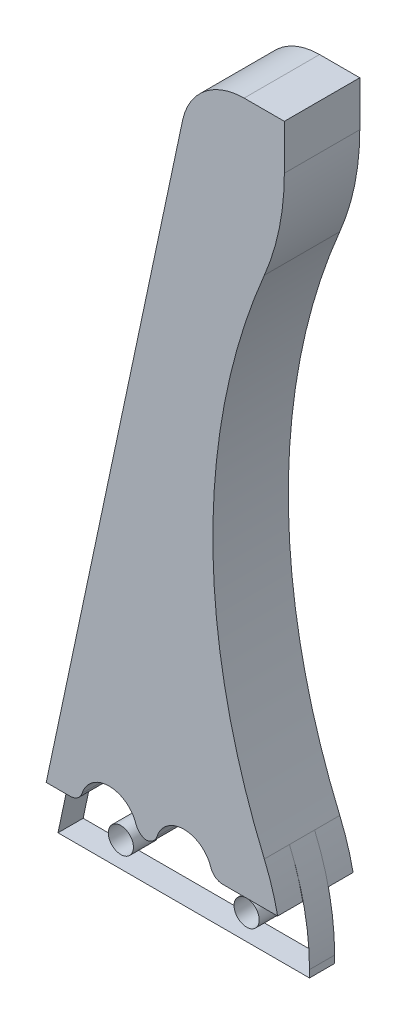
from build123d import *

# Parameters (mm, degrees)
SALIENTE_EXTRUIR1_DEPTH      = 2
REDONDEO1_R                  = 5
REDONDEO2_R                  = 20
REDONDEO3_R                  = 20
CROQUIS3_R                   = 1
CORTAR_EXTRUIR1_DEPTH        = 2
SALIENTE_EXTRUIR2_DEPTH      = 2
SALIENTE_EXTRUIR2_DEPTH_BACK = 4
CORTAR_EXTRUIR2_DEPTH        = 2
REDONDEO4_R                  = 1
CORTAR_EXTRUIR3_START        = -2
CORTAR_EXTRUIR3_DEPTH        = 2
REDONDEO5_R                  = 1


with BuildPart() as part:
    # Croquis1 → Saliente-Extruir1 (new body)
    with BuildSketch(Plane.XY):
        with BuildLine():
            Line((0, 0), (20, 0))
            Line((20, 0), (20, 5))
            ThreePointArc((20, 5), (14.314768742, 28.5), (20, 52))
            Line((20, 52), (20, 60))
            Line((20, 60), (12.7533937, 60))
            Line((12.7533937, 60), (0, 0))
        make_face()
    extrude(amount=SALIENTE_EXTRUIR1_DEPTH)

    # Redondeo1
    redondeo1_edges = [part.edges().sort_by_distance(p)[0] for p in [
        (12.7533937, 60, 1),
    ]]
    fillet(redondeo1_edges, radius=REDONDEO1_R)

    # Redondeo2
    redondeo2_edges = [part.edges().sort_by_distance(p)[0] for p in [
        (20, 52, 1),
    ]]
    fillet(redondeo2_edges, radius=REDONDEO2_R)

    # Redondeo3
    redondeo3_edges = [part.edges().sort_by_distance(p)[0] for p in [
        (20, 5, 1),
    ]]
    fillet(redondeo3_edges, radius=REDONDEO3_R)

    # Croquis3 → Cortar-Extruir1 (cut)
    with BuildSketch(Plane.XY.offset(2)):
        with Locations((5, 2)):
            Circle(CROQUIS3_R)
        with Locations((15, 2)):
            Circle(CROQUIS3_R)
    extrude(amount=-CORTAR_EXTRUIR1_DEPTH, mode=Mode.SUBTRACT)

    # Croquis4 → Saliente-Extruir2 (add, two sides: drawn at the far end of the back side and taken through both)
    with BuildSketch(Plane.XY.offset(2).offset(-SALIENTE_EXTRUIR2_DEPTH_BACK)):
        with BuildLine():
            Line((1.062782808, 5), (19.467344823, 5))
            ThreePointArc((19.467344823, 5), (19.022081332, 6.725242685), (18.407753369, 8.397762657))
            ThreePointArc((18.407753369, 8.397762657), (14.314768742, 28.5), (18.407753369, 48.602237343))
            ThreePointArc((18.407753369, 48.602237343), (19.597896155, 52.432082505), (20, 56.422379023))
            Line((20, 56.422379023), (20, 60))
            Line((20, 60), (16.802313866, 60))
            ThreePointArc((16.802313866, 60), (13.655711911, 58.885729807), (11.911575863, 56.039558454))
            Line((11.911575863, 56.039558454), (1.062782808, 5))
        make_face()
    extrude(amount=SALIENTE_EXTRUIR2_DEPTH + SALIENTE_EXTRUIR2_DEPTH_BACK)

    # Croquis5 → Cortar-Extruir2 (cut)
    with BuildSketch(Plane.XY.offset(4)):
        with BuildLine():
            Line((3.812782808, 5), (8.312782808, 5))
            ThreePointArc((8.312782808, 5), (6.062782808, 7.25), (3.812782808, 5))
        make_face()
        with BuildLine():
            Line((9.765782808, 5), (14.265782808, 5))
            ThreePointArc((14.265782808, 5), (12.015782808, 7.25), (9.765782808, 5))
        make_face()
    extrude(amount=-CORTAR_EXTRUIR2_DEPTH, mode=Mode.SUBTRACT)

    # Redondeo4
    # the kernel refuses this fillet: 1 mm, written as the material it takes off along each edge
    with BuildSketch(Plane(origin=(8.312782808, 5, 6.105823048), x_dir=(1, 0, 0), z_dir=(0, 0, -1)), Plane(origin=(14.265782808, 5, 6.105823048), x_dir=(1, 0, 0), z_dir=(0, 0, -1))) as redondeo4_piece_1:
        with BuildLine():
            CenterArc((0.842329219, -1), REDONDEO4_R, 90, 72.079786861)
            ThreePointArc((-0.109156694, -0.692307692), (-0.0274567, -0.350430137), (0, 0))
            Line((0, 0), (0.842329219, 0))
        make_face()
    extrude(amount=4.105823048, mode=Mode.SUBTRACT)
    with BuildSketch(Plane(origin=(3.812782808, 5, 6.105823048), x_dir=(-1, 0, 0), z_dir=(0, 0, -1))) as redondeo4_piece_2:
        with BuildLine():
            CenterArc((0.842329219, 1), REDONDEO4_R, 197.920213139, 72.079786861)
            ThreePointArc((-0.109156694, 0.692307692), (-0.0274567, 0.350430137), (0, 0))
            Line((0, 0), (0.842329219, 0))
        make_face()
    extrude(amount=4.105823048, mode=Mode.SUBTRACT)
    with BuildSketch(Plane(origin=(9.765782808, 5, 6.105823048), x_dir=(0.15574672772788725, 0.9877970220657962, 0), z_dir=(0, 0, -1))) as redondeo4_piece_3:
        with BuildLine():
            CenterArc((0.856607003, -0.987797022), REDONDEO4_R, 98.96010657, 72.079786861)
            Line((-0.13119002, -0.832050294), (0, 0))
            ThreePointArc((0, 0), (0.350430137, -0.0274567), (0.700860275, 0))
        make_face()
    extrude(amount=4.105823048, mode=Mode.SUBTRACT)

    # Croquis6 → Cortar-Extruir3 (cut)
    with BuildSketch(Plane(origin=(0, 0, -2), x_dir=(-1, 0, 0), z_dir=(0, 0, -1)).offset(CORTAR_EXTRUIR3_START)):
        with BuildLine():
            Line((-8.312782808, 5), (-3.812782808, 5))
            ThreePointArc((-3.812782808, 5), (-6.062782808, 7.25), (-8.312782808, 5))
        make_face()
        with BuildLine():
            Line((-14.242782808, 5), (-9.742782808, 5))
            ThreePointArc((-9.742782808, 5), (-11.992782808, 7.25), (-14.242782808, 5))
        make_face()
    extrude(amount=CORTAR_EXTRUIR3_DEPTH, mode=Mode.SUBTRACT)

    # Redondeo5
    # the kernel refuses this fillet: 1 mm, written as the material it takes off along each edge
    with BuildSketch(Plane(origin=(3.812782808, 5, 2.105823048), x_dir=(-1, 0, 0), z_dir=(0, 0, -1))) as redondeo5_piece_1_section:
        with BuildLine():
            CenterArc((0.842329219, 1), REDONDEO5_R, 197.920213139, 72.079786861)
            ThreePointArc((-0.109156694, 0.692307692), (-0.0274567, 0.350430137), (0, 0))
            Line((0, 0), (0.842329219, 0))
        make_face()
    redondeo5_piece_1 = extrude(amount=6.211646096, mode=Mode.PRIVATE)
    redondeo5_piece_1 = split(redondeo5_piece_1, bisect_by=Plane(origin=(3.627238075, 5.153542941, 2), z_dir=(0, 0, 1)), keep=Keep.TOP, mode=Mode.PRIVATE)
    add(redondeo5_piece_1, mode=Mode.SUBTRACT)
    with BuildSketch(Plane(origin=(3.812782808, 5, 0), x_dir=(-1, 0, 0), z_dir=(0, 0, -1)), Plane(origin=(9.742782808, 5, 0), x_dir=(-1, 0, 0), z_dir=(0, 0, -1))) as redondeo5_piece_2:
        with BuildLine():
            CenterArc((0.842329219, 1), REDONDEO5_R, 197.920213139, 72.079786861)
            ThreePointArc((-0.109156694, 0.692307692), (-0.0274567, 0.350430137), (0, 0))
            Line((0, 0), (0.842329219, 0))
        make_face()
    extrude(amount=4.105823048, mode=Mode.SUBTRACT)
    with BuildSketch(Plane(origin=(8.312782808, 5, 2.105823048), x_dir=(1, 0, 0), z_dir=(0, 0, -1))) as redondeo5_piece_3_section:
        with BuildLine():
            CenterArc((0.842329219, -1), REDONDEO5_R, 90, 72.079786861)
            ThreePointArc((-0.109156694, -0.692307692), (-0.0274567, -0.350430137), (0, 0))
            Line((0, 0), (0.842329219, 0))
        make_face()
    redondeo5_piece_3 = extrude(amount=6.211646096, mode=Mode.PRIVATE)
    redondeo5_piece_3 = split(redondeo5_piece_3, bisect_by=Plane(origin=(8.498327542, 5.153542941, 2), z_dir=(0, 0, 1)), keep=Keep.TOP, mode=Mode.PRIVATE)
    add(redondeo5_piece_3, mode=Mode.SUBTRACT)
    with BuildSketch(Plane(origin=(8.312782808, 5, 0), x_dir=(1, 0, 0), z_dir=(0, 0, -1)), Plane(origin=(14.242782808, 5, 0), x_dir=(1, 0, 0), z_dir=(0, 0, -1))) as redondeo5_piece_4:
        with BuildLine():
            CenterArc((0.842329219, -1), REDONDEO5_R, 90, 72.079786861)
            ThreePointArc((-0.109156694, -0.692307692), (-0.0274567, -0.350430137), (0, 0))
            Line((0, 0), (0.842329219, 0))
        make_face()
    extrude(amount=4.105823048, mode=Mode.SUBTRACT)


solid = part.part
